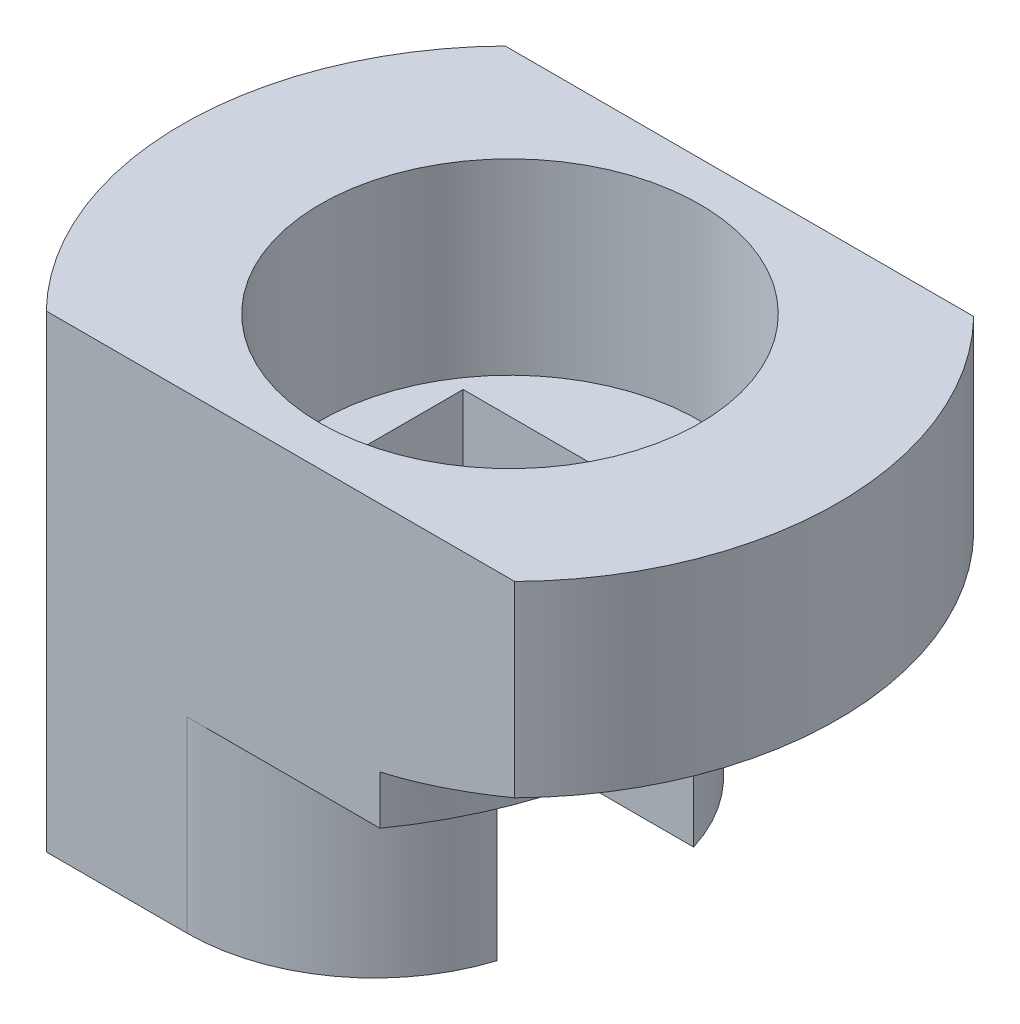
from build123d import *

# Parameters (mm, degrees)
SKETCH1_R           = 7
BOSS_EXTRUDE3_DEPTH = 10
SKETCH4_R           = 4.05
CUT_EXTRUDE1_DEPTH  = 4
SKETCH5_W           = 6.2
SKETCH5_H           = 4.2
CUT_EXTRUDE2_DEPTH  = 6
CUT_EXTRUDE3_DEPTH  = 4
CUT_EXTRUDE4_DEPTH  = 15.071247279
CHAMFER1_SIZE       = 2
CHAMFER1_SIZE_2     = 3.464101615
CUT_EXTRUDE5_DEPTH  = 4
FILLET1_R           = 4


with BuildPart() as part:
    # Sketch1 → Boss-Extrude3 (new body)
    with BuildSketch(Plane(origin=(0, 0, 0), x_dir=(1, 0, 0), z_dir=(0, 1, 0))):
        with Locations(Location((0, 0, 0), (0, 0, 270))):
            Circle(SKETCH1_R)
    extrude(amount=BOSS_EXTRUDE3_DEPTH)

    # Sketch4 → Cut-Extrude1 (cut)
    with BuildSketch(Plane(origin=(0, 10, 0), x_dir=(1, 0, 0), z_dir=(0, 1, 0))):
        with Locations(Location((0, 0, 0), (0, 0, 270))):
            Circle(SKETCH4_R)
    extrude(amount=-CUT_EXTRUDE1_DEPTH, mode=Mode.SUBTRACT)

    # Sketch5 → Cut-Extrude2 (cut)
    with BuildSketch(Plane.XZ):
        Rectangle(SKETCH5_W, SKETCH5_H)
    extrude(amount=-CUT_EXTRUDE2_DEPTH, mode=Mode.SUBTRACT)

    # Sketch6 → Cut-Extrude3 (cut)
    with BuildSketch(Plane.XZ):
        with BuildLine():
            ThreePointArc((0, -7), (7, 0), (0, 7))
            ThreePointArc((0, 7), (3.67817462, 0), (0, -7))
        make_face()
    extrude(amount=-CUT_EXTRUDE3_DEPTH, mode=Mode.SUBTRACT)

    # Sketch7 → Cut-Extrude4 (cut, through all)
    with BuildSketch(Plane(origin=(0, 10, 0), x_dir=(1, 0, 0), z_dir=(0, 1, 0))):
        with BuildLine():
            Line((-5, -4.898979486), (5, -4.898979486))
            ThreePointArc((5, -4.898979486), (0, -7), (-5, -4.898979486))
        make_face()
        with BuildLine():
            Line((5, 4.898979486), (-5, 4.898979486))
            ThreePointArc((-5, 4.898979486), (0, 16.797958971), (5, 4.898979486))
        make_face()
    extrude(amount=-CUT_EXTRUDE4_DEPTH, mode=Mode.SUBTRACT)

    # Chamfer1
    # the kernel refuses this chamfer: 3.464101615, 2 mm, written as the material it takes off along each edge
    with BuildSketch(Plane(origin=(0, 4, 0), x_dir=(-0.4663618278566538, 0, -0.8845940569087047), z_dir=(-0.8845940569087047, 0, 0.4663618278566538))) as chamfer1_piece_1_section:
        Polygon((7, -CHAMFER1_SIZE), (7 - CHAMFER1_SIZE_2, 0), (7, 0), align=None)
    chamfer1_piece_1 = revolve(axis=Axis((0, 4, 0), (0, -1, 0)), revolution_arc=235.596785732, mode=Mode.PRIVATE)
    chamfer1_piece_1 = chamfer1_piece_1 - Plane(origin=(-4.82182538, 5.041782237, 0), x_dir=(0.5672735741760563, 0, 0.8235294117647058), z_dir=(0, -1, 0)) * Cylinder(8.5, 29, mode=Mode.PRIVATE)
    add(chamfer1_piece_1, mode=Mode.SUBTRACT)

    # Sketch10 → Cut-Extrude5 (cut)
    with BuildSketch(Plane.XZ):
        with BuildLine():
            Line((1.820847698, -4.898979486), (1.820847698, 4.898979486))
            Line((1.820847698, 4.898979486), (2.124396614, 4.898979486))
            ThreePointArc((2.124396614, 4.898979486), (3.67817462, 0), (2.124396614, -4.898979486))
            Line((2.124396614, -4.898979486), (1.820847698, -4.898979486))
        make_face()
    extrude(amount=-CUT_EXTRUDE5_DEPTH, mode=Mode.SUBTRACT)

    # Fillet1
    # the kernel refuses this fillet: 4 mm, written as the material it takes off along each edge
    with BuildSketch(Plane(origin=(1.820847698, -9.538589297, 4.898979486), x_dir=(-1, 0, 0), z_dir=(0, 1, 0))) as fillet1_piece_1:
        with BuildLine():
            CenterArc((3.815435719, -4), FILLET1_R, 90, 72.527072621)
            Line((0, -2.798979486), (0, 0))
            Line((0, 0), (3.815435719, 0))
        make_face()
    extrude(amount=13.538589297, mode=Mode.SUBTRACT)
    with BuildSketch(Plane(origin=(1.820847698, -9.538589297, -4.898979486), x_dir=(-1, 0, 0), z_dir=(0, 1, 0))) as fillet1_piece_2:
        with BuildLine():
            CenterArc((3.815435719, 4), FILLET1_R, 197.472927379, 72.527072621)
            Line((0, 2.798979486), (0, 0))
            Line((0, 0), (3.815435719, 0))
        make_face()
    extrude(amount=13.538589297, mode=Mode.SUBTRACT)


solid = part.part
